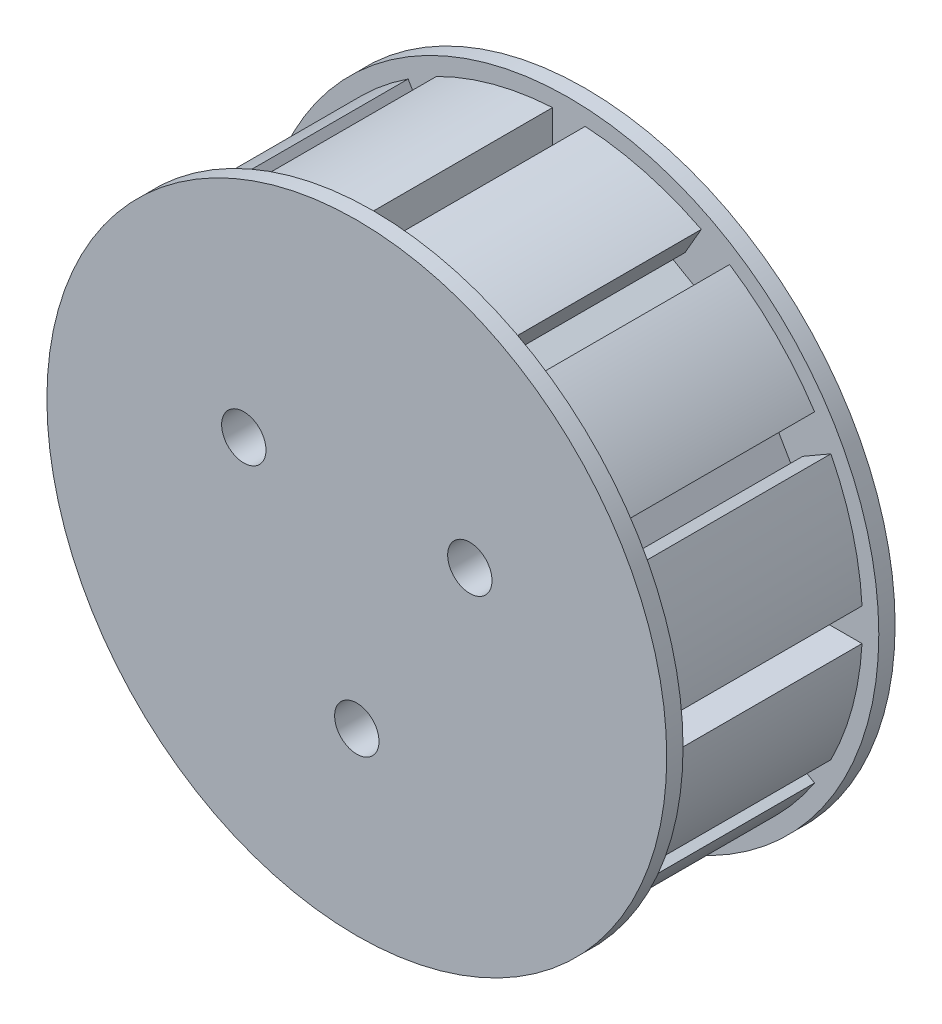
from build123d import *

# Parameters (mm, degrees)
SKETCH1_R           = 28.575
BOSS_EXTRUDE1_DEPTH = 9.525
CUT_EXTRUDE1_DEPTH  = 9.525
CIRPATTERN1_COUNT   = 12
SKETCH3_R           = 30.1625
BOSS_EXTRUDE2_DEPTH = 1.5875
SKETCH4_R           = 2.159
CUT_EXTRUDE2_DEPTH  = 49.098892269


with BuildPart() as part:
    # Sketch1 → Boss-Extrude1 (new, symmetric)
    with BuildSketch(Plane.XY):
        Circle(SKETCH1_R)
    extrude(amount=BOSS_EXTRUDE1_DEPTH, both=True)

    # Sketch2 → Cut-Extrude1 (cut, symmetric)
    with BuildSketch(Plane.XY):
        with BuildLine():
            Line((-1.5875, 28.5308687), (-1.5875, 25.3558687))
            Line((-1.5875, 25.3558687), (-4.7625, 25.3558687))
            Line((-4.7625, 25.3558687), (-4.7625, 23.7683687))
            Line((-4.7625, 23.7683687), (4.7625, 23.7683687))
            Line((4.7625, 23.7683687), (4.7625, 25.3558687))
            Line((4.7625, 25.3558687), (1.5875, 25.3558687))
            Line((1.5875, 25.3558687), (1.5875, 28.5308687))
            ThreePointArc((1.5875, 28.5308687), (0, 28.575), (-1.5875, 28.5308687))
        make_face()
    cut_extrude1 = extrude(amount=CUT_EXTRUDE1_DEPTH, both=True, mode=Mode.SUBTRACT)

    # CirPattern1: Cut-Extrude1 ×12 about axis
    cirpattern1_axis = Axis((0, 0, 9.525), (0, 0, 1))
    for i in range(1, CIRPATTERN1_COUNT):
        add(cut_extrude1.rotate(cirpattern1_axis, i * 360 / CIRPATTERN1_COUNT), mode=Mode.SUBTRACT)

    # Sketch3 → Boss-Extrude2 (add)
    with BuildSketch(Plane(origin=(0, 0, -9.525), x_dir=(-1, 0, 0), z_dir=(0, 0, -1))):
        Circle(SKETCH3_R)
    boss_extrude2 = extrude(amount=BOSS_EXTRUDE2_DEPTH)

    # Mirror1: Boss-Extrude2 across plane
    add(boss_extrude2.mirror(Plane.XY))

    # Sketch4 → Cut-Extrude2 (cut, through all)
    with BuildSketch(Plane(origin=(0, 0, -11.1125), x_dir=(-1, 0, 0), z_dir=(0, 0, -1))):
        with Locations((0, -12.7)):
            Circle(SKETCH4_R)
        with Locations((-10.998522628, 6.35)):
            Circle(SKETCH4_R)
        with Locations((10.998522628, 6.35)):
            Circle(SKETCH4_R)
    extrude(amount=-CUT_EXTRUDE2_DEPTH, mode=Mode.SUBTRACT)


solid = part.part
